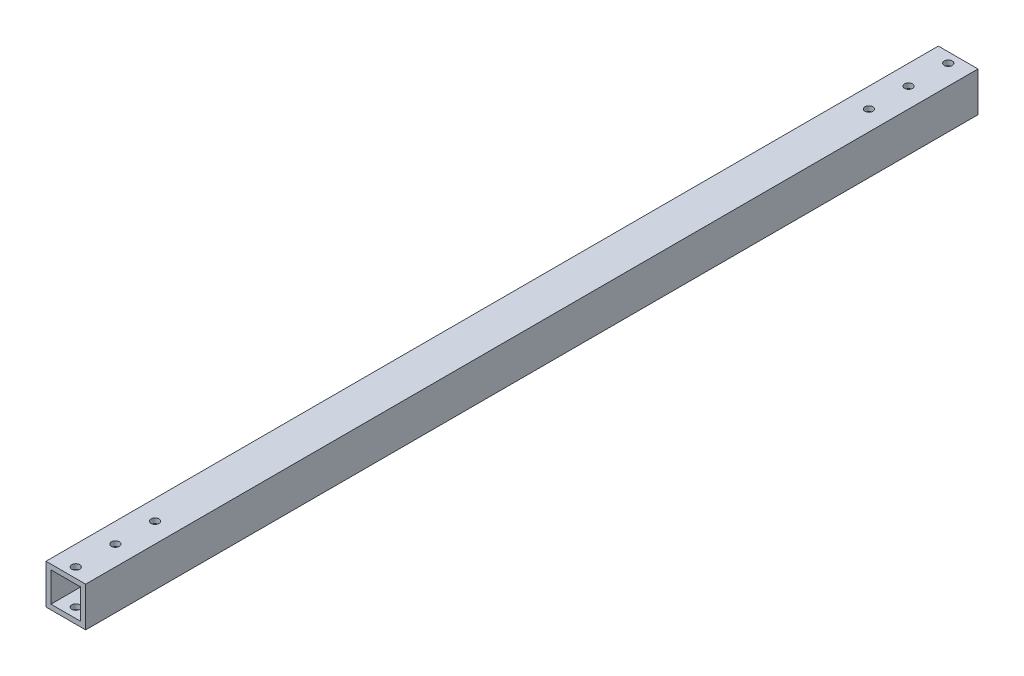
from build123d import *

# Parameters (mm, degrees)
SKETCH1_W              = 25.4
SKETCH1_H              = 25.4
SKETCH1_W_2            = 19.05
SKETCH1_H_2            = 19.05
EXTRUDE_THIN1_DEPTH    = 571.5
F_10_CLEARANCE_HOLE1_D = 5.1054


with BuildPart() as part:
    # Sketch1 → Extrude-Thin1 (new body)
    with BuildSketch(Plane.XY):
        Rectangle(SKETCH1_W, SKETCH1_H)
        Rectangle(SKETCH1_W_2, SKETCH1_H_2, mode=Mode.SUBTRACT)
    extrude(amount=EXTRUDE_THIN1_DEPTH)

    # #10 Clearance Hole1 (through all)
    with Locations(Plane(origin=(0, 12.7, 565.15), x_dir=(0, 0, 1), z_dir=(0, 1, 0))):
        with Locations((0, 0), (-558.8, 0), (-533.4, 0), (-508, 0), (-25.4, 0), (-50.8, 0)):
            Hole(F_10_CLEARANCE_HOLE1_D / 2)


solid = part.part
